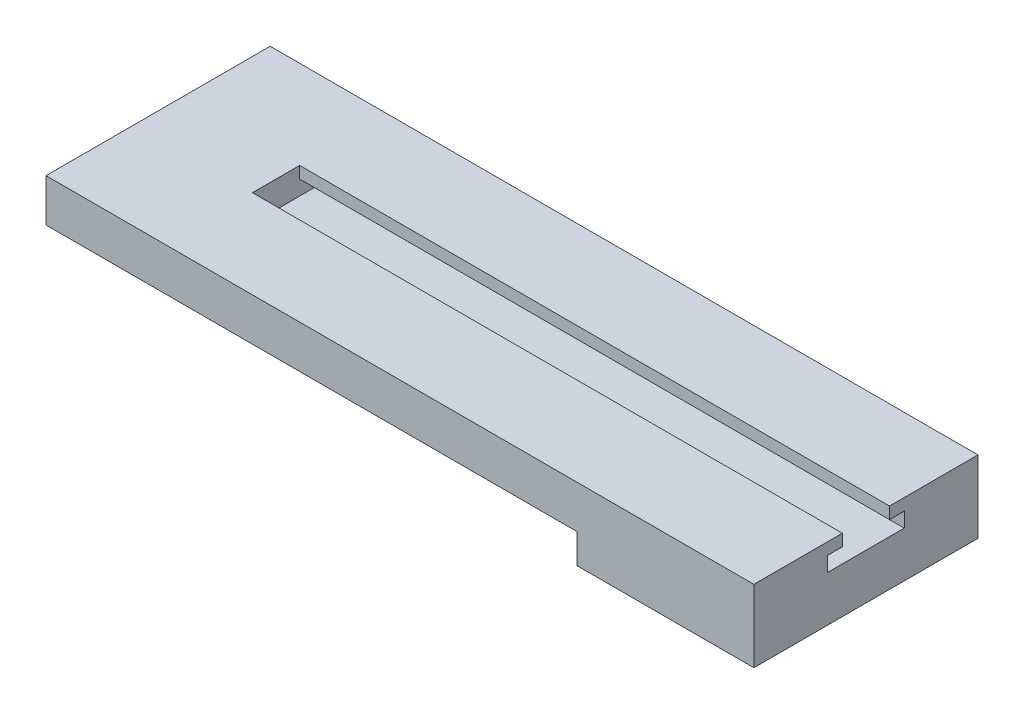
from build123d import *

# Parameters (mm, degrees)
BOSS_EXTRUDE1_DEPTH = 4
BOSS_EXTRUDE2_DEPTH = 5
BOSS_EXTRUDE3_START = -5
SKETCH3_W           = 240
SKETCH3_H           = 76
BOSS_EXTRUDE3_DEPTH = 5.5
BOSS_EXTRUDE4_START = -10.5
SKETCH4_W           = 60
SKETCH4_H           = 76
BOSS_EXTRUDE4_DEPTH = 10
CUT_EXTRUDE1_START  = -21
CUT_EXTRUDE1_DEPTH  = 8


with BuildPart() as part:
    # Sketch1 → Boss-Extrude1 (new body)
    with BuildSketch(Plane(origin=(0, 0, 0), x_dir=(1, 0, 0), z_dir=(0, 1, 0))):
        Polygon((0, 0), (200, 0), (200, 30), (-40, 30), (-40, -46), (200, -46), (200, -16), (0, -16), align=None)
    extrude(amount=BOSS_EXTRUDE1_DEPTH)

    # Sketch2 → Boss-Extrude2 (add)
    with BuildSketch(Plane(origin=(0, 0, 0), x_dir=(1, 0, 0), z_dir=(0, 1, 0))):
        Polygon((200, 5), (0, 5), (0, -21), (200, -21), (200, -46), (-40, -46), (-40, 30), (200, 30), align=None)
    extrude(amount=-BOSS_EXTRUDE2_DEPTH)

    # Sketch3 → Boss-Extrude3 (add)
    with BuildSketch(Plane(origin=(0, 0, 0), x_dir=(1, 0, 0), z_dir=(0, 1, 0)).offset(BOSS_EXTRUDE3_START)):
        with Locations((80, -8)):
            Rectangle(SKETCH3_W, SKETCH3_H)
    extrude(amount=-BOSS_EXTRUDE3_DEPTH)

    # Sketch4 → Boss-Extrude4 (add)
    with BuildSketch(Plane(origin=(0, 0, 0), x_dir=(1, 0, 0), z_dir=(0, 1, 0)).offset(BOSS_EXTRUDE4_START)):
        with Locations((170, -8)):
            Rectangle(SKETCH4_W, SKETCH4_H)
    extrude(amount=-BOSS_EXTRUDE4_DEPTH)

    # Sketch5 → Cut-Extrude1 (cut)
    with BuildSketch(Plane(origin=(0, 0, 0), x_dir=(1, 0, 0), z_dir=(0, 1, 0)).offset(CUT_EXTRUDE1_START)):
        Polygon((170, -23), (172.5, -23), (172.5, -10), (177.5, -10), (177.5, -6), (172.5, -6), (172.5, 7), (170, 7), (167.5, 7), (167.5, -6), (162.5, -6), (162.5, -10), (167.5, -10), (167.5, -23), align=None)
    extrude(amount=CUT_EXTRUDE1_DEPTH, mode=Mode.SUBTRACT)


solid = part.part
